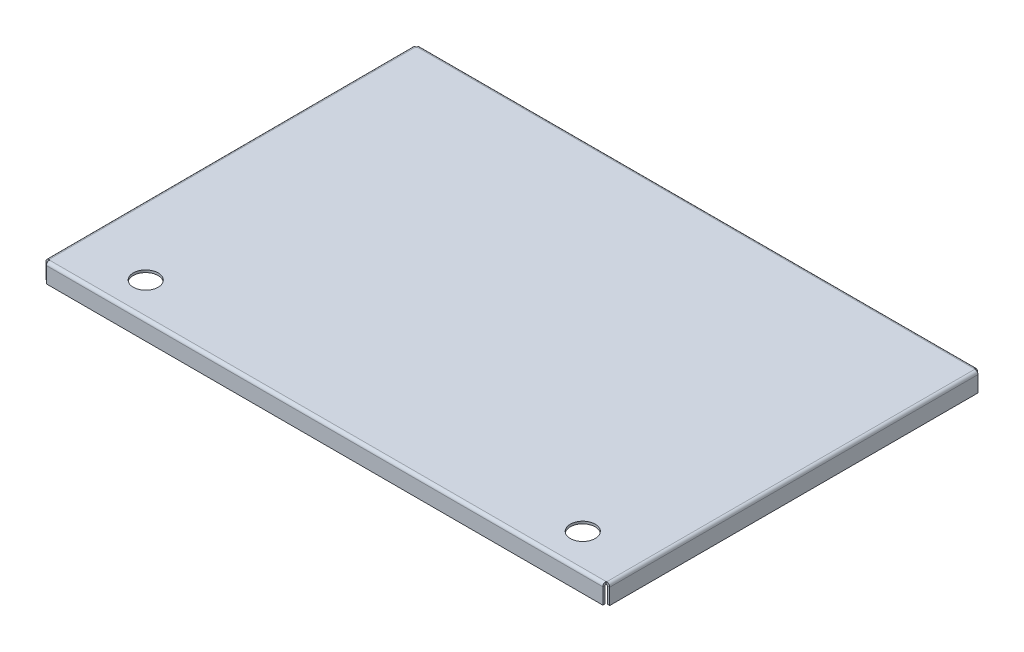
from build123d import *

# Parameters (mm, degrees)
BASE_FLANGE1_DEPTH       = 2.286
EDGE_FLANGE17_DEPTH      = 540.189115874
EDGE_FLANGE17_BEND_DEPTH = 539.451478538
EDGE_FLANGE18_DEPTH      = 357.000345524
EDGE_FLANGE18_BEND_DEPTH = 356.321109034
SKETCH197_R              = 12.065
CUT_EXTRUDE1_DEPTH       = 652.69497057


# Sheet-metal steps are written as plain solids
with BuildPart() as part:
    # Sketch1 → Base-Flange1 (new body)
    with BuildSketch(Plane(origin=(0, 0, 0), x_dir=(1, 0, 0), z_dir=(0, 1, 0))):
        Polygon((539.451478538, 356.320345524), (0, 356.320345524), (-0.737637336, 356.320345524), (0, 0), (539.451478538, 0), align=None)
    extrude(amount=-BASE_FLANGE1_DEPTH)

    # Edge-Flange17 section (across the edge) → Edge-Flange17 (add)
    with BuildSketch(Plane(origin=(-0.737637336, -2.286, -357.396945524), x_dir=(0, 0, 1), z_dir=(1, 0, 0))):
        with BuildLine():
            Line((-2.286, 0.7366), (-2.286, 16.15))
            Line((-2.286, 16.15), (0, 16.15))
            Line((0, 16.15), (0, 0.7366))
            ThreePointArc((0, 0.7366), (0.215745145, 0.215745145), (0.7366, 0))
            Line((0.7366, 0), (1.0766, 0))
            Line((1.0766, 0), (1.0766, -2.286))
            Line((1.0766, -2.286), (0.7366, -2.286))
            ThreePointArc((0.7366, -2.286), (-1.400700957, -1.400700957), (-2.286, 0.7366))
        make_face()
    extrude(amount=EDGE_FLANGE17_DEPTH)

    # Edge-Flange17 section 2 (across the edge) → Edge-Flange17 bend (add)
    with BuildSketch(Plane(origin=(539.451478538, -2.286, 1.0766), x_dir=(0, 0, -1), z_dir=(-1, 0, 0))):
        with BuildLine():
            Line((-2.286, 0.7366), (-2.286, 16.15))
            Line((-2.286, 16.15), (0, 16.15))
            Line((0, 16.15), (0, 0.7366))
            ThreePointArc((0, 0.7366), (0.215745145, 0.215745145), (0.7366, 0))
            Line((0.7366, 0), (1.0766, 0))
            Line((1.0766, 0), (1.0766, -2.286))
            Line((1.0766, -2.286), (0.7366, -2.286))
            ThreePointArc((0.7366, -2.286), (-1.400700957, -1.400700957), (-2.286, 0.7366))
        make_face()
    extrude(amount=EDGE_FLANGE17_BEND_DEPTH)

    # Edge-Flange18 section (across the edge) → Edge-Flange18 (add)
    with BuildSketch(Plane(origin=(540.848078538, -2.286, -356.660345524), x_dir=(-1, 0, 0), z_dir=(0, 0, 1))):
        with BuildLine():
            Line((-2.286, 0.7366), (-2.286, 16.15))
            Line((-2.286, 16.15), (0, 16.15))
            Line((0, 16.15), (0, 0.7366))
            ThreePointArc((0, 0.7366), (0.215745145, 0.215745145), (0.7366, 0))
            Line((0.7366, 0), (1.3966, 0))
            Line((1.3966, 0), (1.3966, -2.286))
            Line((1.3966, -2.286), (0.7366, -2.286))
            ThreePointArc((0.7366, -2.286), (-1.400700957, -1.400700957), (-2.286, 0.7366))
        make_face()
    extrude(amount=EDGE_FLANGE18_DEPTH)

    # Edge-Flange18 section 2 (across the edge) → Edge-Flange18 bend (add)
    with BuildSketch(Plane(origin=(-1.396597007, -2.286, 0.002891168), x_dir=(0.9999978572418866, -3.4914813388431337e-15, -0.0020701477327567633), z_dir=(-0.0020701477327567633, 0, -0.9999978572418866))):
        with BuildLine():
            Line((-2.286, 0.7366), (-2.286, 16.15))
            Line((-2.286, 16.15), (0, 16.15))
            Line((0, 16.15), (0, 0.7366))
            ThreePointArc((0, 0.7366), (0.215745145, 0.215745145), (0.7366, 0))
            Line((0.7366, 0), (1.3966, 0))
            Line((1.3966, 0), (1.3966, -2.286))
            Line((1.3966, -2.286), (0.7366, -2.286))
            ThreePointArc((0.7366, -2.286), (-1.400700957, -1.400700957), (-2.286, 0.7366))
        make_face()
    extrude(amount=EDGE_FLANGE18_BEND_DEPTH)

    # Sketch197 → Cut-Extrude1 (cut, through all)
    with BuildSketch(Plane(origin=(0, 0, 0), x_dir=(1, 0, 0), z_dir=(0, 1, 0))):
        with Locations(Location((486.180210266, 30.458714935, 0), (0, 0, 270))):
            Circle(SKETCH197_R)
        with Locations(Location((63.390735832, 29.575349793, 0), (0, 0, 270))):
            Circle(SKETCH197_R)
    extrude(amount=-CUT_EXTRUDE1_DEPTH, mode=Mode.SUBTRACT)


solid = part.part
